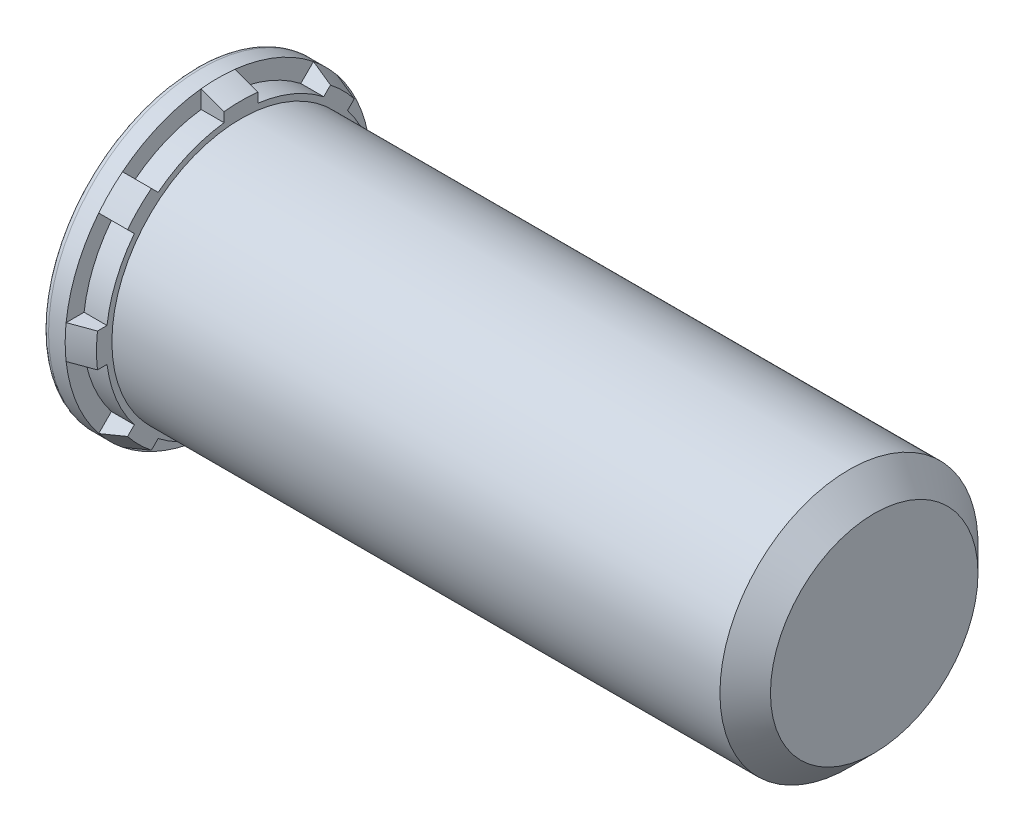
from build123d import *

# Parameters (mm, degrees)
RIBCUT_START     = -0.428625
RIBCUT_DEPTH     = 0.428625
RIBCUTSPAT_COUNT = 8
RIBCUTSPAT_ANGLE = 315


with BuildPart() as part:
    # BodySke → BaseBody (revolve)
    with BuildSketch(Plane.XY):
        with BuildLine():
            Line((-0.428625, 2.74066), (-0.428625, 0))
            Line((-0.428625, 0), (12.271375, 0))
            Line((12.271375, 0), (12.271375, 1.94056))
            Line((12.271375, 1.94056), (11.798935, 2.413))
            Line((11.798935, 2.413), (0.428625, 2.413))
            Line((0.428625, 2.413), (0.428625, 2.701493258))
            Line((0.428625, 2.701493258), (0, 2.8575))
            Line((0, 2.8575), (-0.311785, 2.8575))
            ThreePointArc((-0.311785, 2.8575), (-0.392607305, 2.824022305), (-0.426085, 2.7432))
            Line((-0.426085, 2.7432), (-0.426085, 2.74066))
            Line((-0.426085, 2.74066), (-0.428625, 2.74066))
        make_face()
    revolve(axis=Axis((0, 0, 0), (1, 0, 0)))

    # RibCutSke → RibCut (cut)
    with BuildSketch(Plane(origin=(0.428625, 1.794401132, -0.090952894), x_dir=(0, 0, -1), z_dir=(1, 0, 0)).offset(RIBCUT_START)):
        with BuildLine():
            Line((0.224006808, 0.70999648), (0.224006808, 1.045688063))
            ThreePointArc((0.224006808, 1.045688063), (1.002565014, 0.845584632), (1.694583294, 0.436555338))
            Line((1.694583294, 0.436555338), (1.4572135, 0.199185543))
            ThreePointArc((1.4572135, 0.199185543), (0.874987925, 0.537586293), (0.224006808, 0.70999648))
        make_face()
    ribcut = extrude(amount=RIBCUT_DEPTH, mode=Mode.SUBTRACT)

    # RibCutsPat: RibCut ×8 about axis
    ribcutspat_axis = Axis((0, 0, 0), (1, 0, 0))
    for i in range(1, RIBCUTSPAT_COUNT):
        add(ribcut.rotate(ribcutspat_axis, i * RIBCUTSPAT_ANGLE / (RIBCUTSPAT_COUNT - 1)), mode=Mode.SUBTRACT)


solid = part.part
